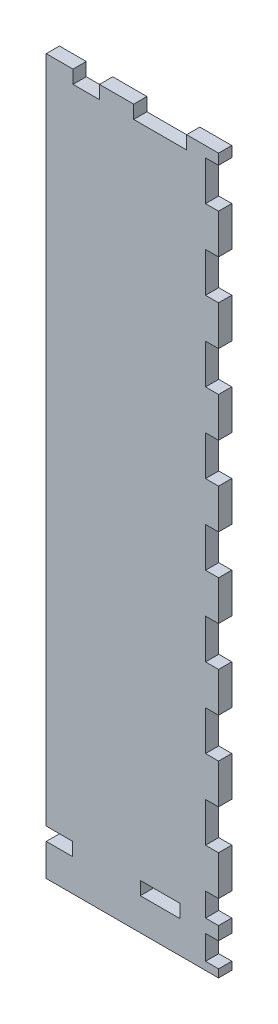
from build123d import *

# Parameters (mm, degrees)
ESQUISSE1_W             = 65.121094869
ESQUISSE1_H             = 270
BOSS_EXTRU_1_DEPTH      = 5
ESQUISSE2_W             = 10
ESQUISSE2_H             = 5
ESQUISSE2_W_2           = 15
ESQUISSE2_W_3           = 4.92
ESQUISSE2_H_2           = 9.15
ESQUISSE2_H_3           = 8.85
ESQUISSE2_H_4           = 15
ESQUISSE2_W_4           = 20
ENL_V_MAT_EXTRU_1_DEPTH = 5


with BuildPart() as part:
    # Esquisse1 → Boss.-Extru.1 (new body)
    with BuildSketch(Plane.XY):
        with Locations((32.560547435, 135)):
            Rectangle(ESQUISSE1_W, ESQUISSE1_H)
    extrude(amount=-BOSS_EXTRU_1_DEPTH)

    # Esquisse2 → Enlèv. mat.-Extru.1 (cut)
    with BuildSketch(Plane.XY):
        with Locations((5, 14.65)):
            Rectangle(ESQUISSE2_W, ESQUISSE2_H)
        with Locations((43.049292824, 14.65)):
            Rectangle(ESQUISSE2_W_2, ESQUISSE2_H)
        with Locations((62.661094869, 7.575)):
            Rectangle(ESQUISSE2_W_3, ESQUISSE2_H_2)
        with Locations((62.661094869, 21.575)):
            Rectangle(ESQUISSE2_W_3, ESQUISSE2_H_3)
        with Locations((62.661094869, 258.5)):
            Rectangle(ESQUISSE2_W_3, ESQUISSE2_H_4)
        with Locations((62.661094869, 228.5)):
            Rectangle(ESQUISSE2_W_3, ESQUISSE2_H_4)
        with Locations((62.661094869, 198.5)):
            Rectangle(ESQUISSE2_W_3, ESQUISSE2_H_4)
        with Locations((62.661094869, 168.5)):
            Rectangle(ESQUISSE2_W_3, ESQUISSE2_H_4)
        with Locations((62.661094869, 138.5)):
            Rectangle(ESQUISSE2_W_3, ESQUISSE2_H_4)
        with Locations((62.661094869, 108.5)):
            Rectangle(ESQUISSE2_W_3, ESQUISSE2_H_4)
        with Locations((62.661094869, 78.5)):
            Rectangle(ESQUISSE2_W_3, ESQUISSE2_H_4)
        with Locations((62.661094869, 48.5)):
            Rectangle(ESQUISSE2_W_3, ESQUISSE2_H_4)
        with Locations((15.121094869, 267.5)):
            Rectangle(ESQUISSE2_W, ESQUISSE2_H)
        with Locations((43.049292824, 267.5)):
            Rectangle(ESQUISSE2_W_4, ESQUISSE2_H)
    extrude(amount=-ENL_V_MAT_EXTRU_1_DEPTH, mode=Mode.SUBTRACT)


solid = part.part
